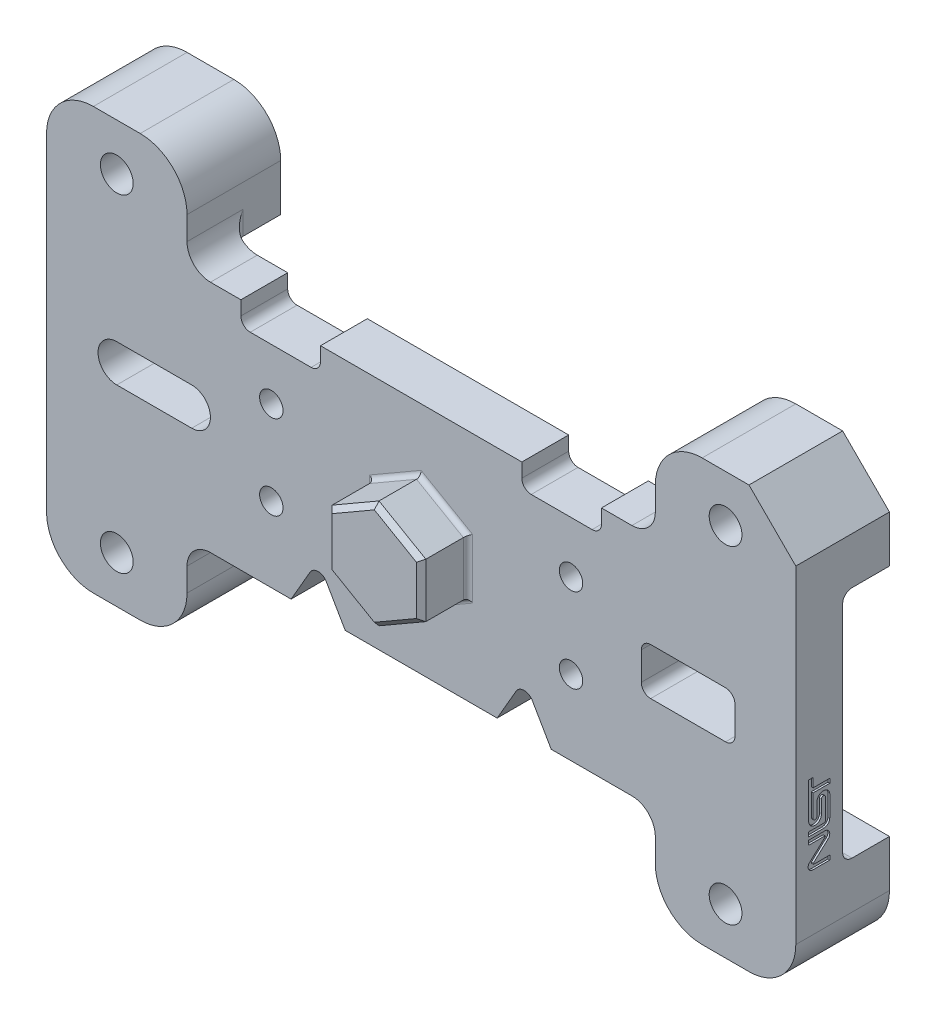
from build123d import *

# Parameters (mm, degrees)
BOSS_EXTRUDE1_DEPTH         = 100
BOSS_EXTRUDE2_DEPTH         = 50
CUT_EXTRUDE1_DEPTH          = 50
FILLET1_R                   = 10
F_20MM_DIAMETER_HOLE1_D     = 20
F_20MM_DIAMETER_HOLE1_DEPTH = 45
F_20MM_DIAMETER_HOLE1_TIP   = 6.00860619
F_35MM_DIAMETER_HOLE1_D     = 35
F_25MM_DIAMETER_HOLE2_D     = 25
FILLET2_R                   = 5
CHAMFER1_SIZE               = 5
CUT_EXTRUDE2_DEPTH          = 2


with BuildPart() as part:
    # Sketch1 → Boss-Extrude1 (new body)
    with BuildSketch(Plane.XY):
        with BuildLine():
            Line((300, -225), (350, -225))
            ThreePointArc((350, -225), (385.355339059, -210.355339059), (400, -175))
            Line((400, -175), (400, 175))
            Line((400, 175), (350, 225))
            Line((350, 225), (300, 225))
            ThreePointArc((300, 225), (264.644660941, 210.355339059), (250, 175))
            Line((250, 175), (250, 150))
            ThreePointArc((250, 150), (242.67766953, 132.32233047), (225, 125))
            Line((225, 125), (192.5, 125))
            Line((192.5, 125), (192.5, 110))
            ThreePointArc((192.5, 110), (189.571067812, 102.928932188), (182.5, 100))
            Line((182.5, 100), (117.5, 100))
            ThreePointArc((117.5, 100), (110.428932188, 102.928932188), (107.5, 110))
            Line((107.5, 110), (107.5, 125))
            Line((107.5, 125), (-107.5, 125))
            Line((-107.5, 125), (-107.5, 110))
            ThreePointArc((-107.5, 110), (-110.428932188, 102.928932188), (-117.5, 100))
            Line((-117.5, 100), (-182.5, 100))
            ThreePointArc((-182.5, 100), (-189.571067812, 102.928932188), (-192.5, 110))
            Line((-192.5, 110), (-192.5, 125))
            Line((-192.5, 125), (-225, 125))
            ThreePointArc((-225, 125), (-242.67766953, 132.32233047), (-250, 150))
            Line((-250, 150), (-250, 175))
            ThreePointArc((-250, 175), (-264.644660941, 210.355339059), (-300, 225))
            Line((-300, 225), (-350, 225))
            ThreePointArc((-350, 225), (-385.355339059, 210.355339059), (-400, 175))
            Line((-400, 175), (-400, -175))
            ThreePointArc((-400, -175), (-385.355339059, -210.355339059), (-350, -225))
            Line((-350, -225), (-300, -225))
            ThreePointArc((-300, -225), (-264.644660941, -210.355339059), (-250, -175))
            Line((-250, -175), (-250, -150))
            ThreePointArc((-250, -150), (-242.67766953, -132.32233047), (-225, -125))
            Line((-225, -125), (-138.867513459, -125))
            Line((-138.867513459, -125), (-118.660254038, -90))
            ThreePointArc((-118.660254038, -90), (-110, -85), (-101.339745962, -90))
            Line((-101.339745962, -90), (-81.132486541, -125))
            Line((-81.132486541, -125), (81.132486541, -125))
            Line((81.132486541, -125), (101.339745962, -90))
            ThreePointArc((101.339745962, -90), (110, -85), (118.660254038, -90))
            Line((118.660254038, -90), (138.867513459, -125))
            Line((138.867513459, -125), (225, -125))
            ThreePointArc((225, -125), (242.67766953, -132.32233047), (250, -150))
            Line((250, -150), (250, -175))
            ThreePointArc((250, -175), (264.644660941, -210.355339059), (300, -225))
        make_face()
        with BuildLine():
            Line((245, 25), (325, 25))
            ThreePointArc((325, 25), (332.071067812, 22.071067812), (335, 15))
            Line((335, 15), (335, -15))
            ThreePointArc((335, -15), (332.071067812, -22.071067812), (325, -25))
            Line((325, -25), (245, -25))
            ThreePointArc((245, -25), (237.928932188, -22.071067812), (235, -15))
            Line((235, -15), (235, 15))
            ThreePointArc((235, 15), (237.928932188, 22.071067812), (245, 25))
        make_face(mode=Mode.SUBTRACT)
        with BuildLine():
            Line((-325, 20), (-245, 20))
            ThreePointArc((-245, 20), (-225, 0), (-245, -20))
            Line((-245, -20), (-325, -20))
            ThreePointArc((-325, -20), (-345, 0), (-325, 20))
        make_face(mode=Mode.SUBTRACT)
    extrude(amount=-BOSS_EXTRUDE1_DEPTH)

    # Sketch2 → Boss-Extrude2 (add)
    with BuildSketch(Plane.XY):
        Polygon((0, 57.735026919), (-50, 28.867513459), (-50, -28.867513459), (0, -57.735026919), (50, -28.867513459), (50, 28.867513459), align=None)
    extrude(amount=BOSS_EXTRUDE2_DEPTH)

    # Sketch3 → Cut-Extrude1 (cut)
    with BuildSketch(Plane(origin=(0, 0, -100), x_dir=(-1, 0, 0), z_dir=(0, 0, -1))):
        Polygon((-250, -125), (-250, -285.839323507), (250, -285.839323507), (250, -125), (518.137746539, -125), (518.137746539, 125), (250, 125), (250, 257.341747448), (-250, 257.341747448), (-250, 125), (-508.638554519, 125), (-508.638554519, -125), align=None)
    extrude(amount=-CUT_EXTRUDE1_DEPTH, mode=Mode.SUBTRACT)

    # Fillet1
    fillet1_edges = [part.edges().sort_by_distance(p)[0] for p in [
        (325, -125, -50),
        (250, -137.5, -50),
        (-250, -137.5, -50),
        (-325, -125, -50),
        (-250, 137.5, -50),
        (-325, 125, -50),
        (250, 137.5, -50),
        (325, 125, -50),
    ]]
    fillet(fillet1_edges, radius=FILLET1_R)

    # Ø20mm Diameter Hole1
    with Locations(Plane(origin=(0, -125, 0), x_dir=(-1, 0, 0), z_dir=(0, -1, 0))):
        with Locations((30, 25), (-30, 25)):
            Hole(F_20MM_DIAMETER_HOLE1_D / 2, depth=F_20MM_DIAMETER_HOLE1_DEPTH)
            with Locations((0, 0, -(F_20MM_DIAMETER_HOLE1_DEPTH + F_20MM_DIAMETER_HOLE1_TIP / 2))):  # 118° drill point
                Cone(0, F_20MM_DIAMETER_HOLE1_D / 2, F_20MM_DIAMETER_HOLE1_TIP, mode=Mode.SUBTRACT)

    # Ø35mm Diameter Hole1 (through all)
    with Locations(Plane.XY):
        with Locations((-325, -175), (-325, 175), (325, 175), (325, -175)):
            Hole(F_35MM_DIAMETER_HOLE1_D / 2)

    # Ø25mm Diameter Hole2 (through all)
    with Locations(Plane.XY):
        with Locations((-160, 45), (-160, -45), (160, -45), (160, 45)):
            Hole(F_25MM_DIAMETER_HOLE2_D / 2)

    # Fillet2
    fillet2_edges = [part.edges().sort_by_distance(p)[0] for p in [
        (-25, -43.301270189, 0),
        (-50, 0, 0),
        (-25, 43.301270189, 0),
        (25, 43.301270189, 0),
        (50, 0, 0),
        (25, -43.301270189, 0),
    ]]
    fillet(fillet2_edges, radius=FILLET2_R)

    # Chamfer1
    chamfer1_edges = [part.edges().sort_by_distance(p)[0] for p in [
        (50, 0, 50),
        (25, -43.301270189, 50),
        (-25, -43.301270189, 50),
        (-50, 0, 50),
        (-25, 43.301270189, 50),
        (25, 43.301270189, 50),
    ]]
    chamfer(chamfer1_edges, length=CHAMFER1_SIZE)

    # Sketch13 → Cut-Extrude2 (cut)
    with BuildSketch(Plane(origin=(400, 0, 0), x_dir=(0, 0, -1), z_dir=(1, 0, 0))):
        with BuildLine():
            Line((13.75, -82.32835225), (29.956393458, -82.32835225))
            ThreePointArc((29.956393458, -82.32835225), (34.406645322, -80.484997572), (36.25, -76.034745708))
            Line((36.25, -76.034745708), (36.25, -53.234015856))
            ThreePointArc((36.25, -53.234015856), (29.482803856, -47.459191239), (22.715607711, -53.234015856))
            Line((22.715607711, -53.234015856), (22.715607711, -67.674157303))
            ThreePointArc((22.715607711, -67.674157303), (20.513731441, -69.787963015), (18.491515998, -67.501682541))
            Line((18.491515998, -67.501682541), (18.491515998, -43.966577311))
            Line((18.491515998, -43.966577311), (36.25, -43.966577311))
            Line((36.25, -43.966577311), (36.25, -39.312838647))
            Line((36.25, -39.312838647), (18.491515998, -39.312838647))
            Line((18.491515998, -39.312838647), (18.491515998, -29.698910626))
            Line((18.491515998, -29.698910626), (13.75, -29.698910626))
            Line((13.75, -29.698910626), (13.75, -68.103804255))
            ThreePointArc((13.75, -68.103804255), (20.828211564, -74.919002147), (27.37062967, -67.587919922))
            Line((27.37062967, -67.587919922), (27.37062967, -54.010152284))
            ThreePointArc((27.37062967, -54.010152284), (29.444202426, -52.069736492), (31.5952347, -53.923914903))
            Line((31.5952347, -53.923914903), (31.5952347, -75.9911137))
            ThreePointArc((31.5952347, -75.9911137), (31.115229214, -77.149949456), (29.956393458, -77.629954942))
            Line((29.956393458, -77.629954942), (13.75, -77.629954942))
            Line((13.75, -77.629954942), (13.75, -82.32835225))
        make_face()
        with BuildLine():
            Line((36.25, -115), (18.006862519, -115))
            ThreePointArc((18.006862519, -115), (13.452018319, -111.891741394), (14.685882931, -106.517222312))
            Line((14.685882931, -106.517222312), (31.336522557, -91.119945246))
            ThreePointArc((31.336522557, -91.119945246), (31.483410925, -90.412511736), (30.862216962, -90.043517938))
            Line((30.862216962, -90.043517938), (13.75, -90.043517938))
            Line((13.75, -90.043517938), (13.75, -85.34512063))
            Line((13.75, -85.34512063), (30.974287192, -85.34512063))
            ThreePointArc((30.974287192, -85.34512063), (35.952415948, -88.87401355), (34.270863268, -94.739781338))
            Line((34.270863268, -94.739781338), (18.836465522, -108.940513926))
            ThreePointArc((18.836465522, -108.940513926), (18.630325097, -109.830724935), (19.384773064, -110.346261336))
            Line((19.384773064, -110.346261336), (36.25, -110.346261336))
            Line((36.25, -110.346261336), (36.25, -115))
        make_face()
    extrude(amount=-CUT_EXTRUDE2_DEPTH, mode=Mode.SUBTRACT)


solid = part.part
